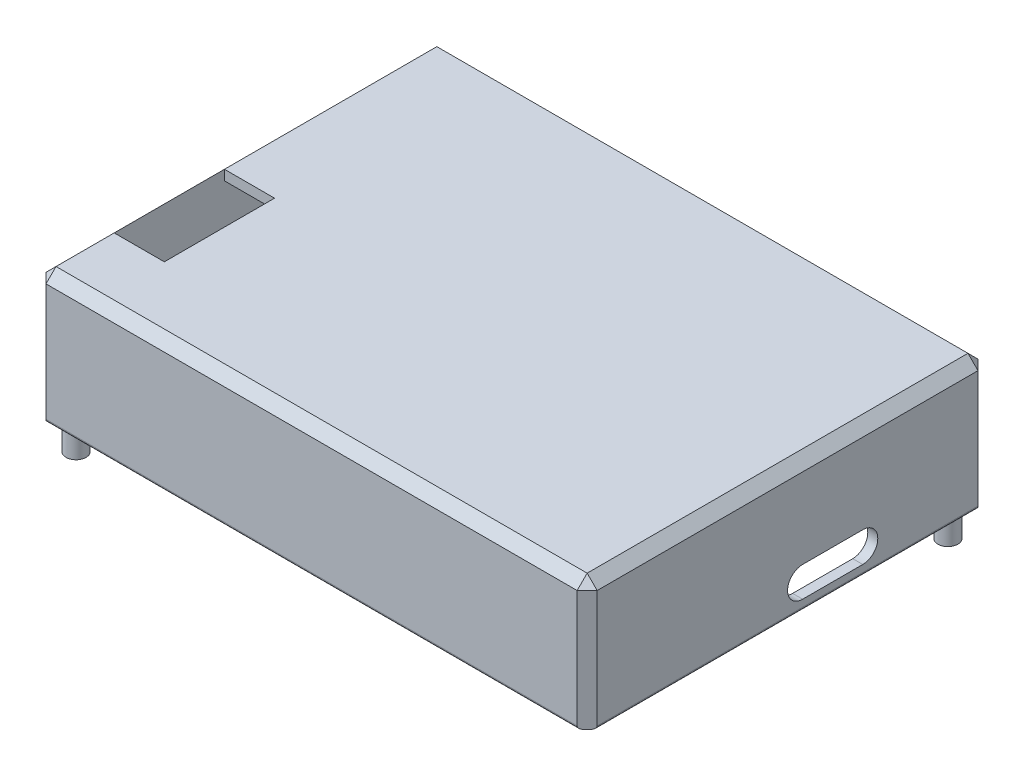
from build123d import *

# Parameters (mm, degrees)
SKETCH_1_W          = 55
SKETCH_1_H          = 40
EXTRUDE_1_DEPTH     = 13
SHELL_1_T           = -1
CHAMFER_1_SIZE      = 1
CUT_EXTRUDE_3_DEPTH = 2
EXTRUDE_5_DEPTH     = 12
SKETCH_16_W         = 5
SKETCH_16_H         = 11
CUT_EXTRUDE_4_DEPTH = 1
SKETCH_18_W         = 8
SKETCH_18_H         = 8
CUT_EXTRUDE_5_DEPTH = 10
SKETCH_19_W         = 1
SKETCH_19_H         = 8
EXTRUDE_6_DEPTH     = 1
SKETCH_21_W         = 0.2
SKETCH_21_H         = 1
CUT_EXTRUDE_6_DEPTH = 12
SKETCH_20_W         = 1.5
SKETCH_20_H         = 10
EXTRUDE_8_DEPTH     = 17.5
EXTRUDE_9_DEPTH     = 10
SKETCH_7_R          = 1
EXTRUDE_4_DEPTH     = 3
FILLET_1_R          = 2
FILLET_2_R          = 0.3
FILLET_3_R          = 0.3


with BuildPart() as part:
    # 草图1 → 凸台-拉伸1 (new body)
    with BuildSketch(Plane(origin=(0, 0, 0), x_dir=(1, 0, 0), z_dir=(0, 1, 0))):
        Rectangle(SKETCH_1_W, SKETCH_1_H)
    extrude(amount=EXTRUDE_1_DEPTH)

    # 抽壳1
    shell_1_openings = [part.faces().sort_by_distance(p)[0] for p in [
        (0, 0, 0),
    ]]
    offset(amount=SHELL_1_T, openings=shell_1_openings, kind=Kind.INTERSECTION)

    # 倒角1
    chamfer_1_edges = [part.edges().sort_by_distance(p)[0] for p in [
        (27.5, 13, 0),
        (0, 13, -20),
        (-27.5, 13, 0),
        (0, 13, 20),
        (-27.5, 6.5, -20),
        (27.5, 6.5, -20),
        (27.5, 6.5, 20),
        (-27.5, 6.5, 20),
    ]]
    chamfer(chamfer_1_edges, length=CHAMFER_1_SIZE)

    # 草图4 → 切除-拉伸3 (cut)
    with BuildSketch(Plane(origin=(27.5, 0, 0), x_dir=(0, 0, -1), z_dir=(1, 0, 0))):
        with BuildLine():
            Line((1.5, 4), (7.5, 4))
            ThreePointArc((7.5, 4), (9, 2.5), (7.5, 1))
            Line((7.5, 1), (1.5, 1))
            ThreePointArc((1.5, 1), (0, 2.5), (1.5, 4))
        make_face()
    extrude(amount=-CUT_EXTRUDE_3_DEPTH, mode=Mode.SUBTRACT)

    # 草图12 → 凸台-拉伸5 (add)
    with BuildSketch(Plane.XZ):
        with BuildLine():
            Line((26.5, -19), (23.5, -19))
            ThreePointArc((23.5, -19), (24.12244212, -16.62244212), (26.5, -16))
            Line((26.5, -16), (26.5, -19))
        make_face()
        with BuildLine():
            Line((-26.5, 19), (-23.5, 19))
            ThreePointArc((-23.5, 19), (-24.12244212, 16.62244212), (-26.5, 16))
            Line((-26.5, 16), (-26.5, 19))
        make_face()
    extrude(amount=-EXTRUDE_5_DEPTH)

    # 草图16 → 切除-拉伸4 (cut)
    with BuildSketch(Plane(origin=(0, 13, 0), x_dir=(1, 0, 0), z_dir=(0, 1, 0))):
        with Locations((-24, -7.69336468)):
            Rectangle(SKETCH_16_W, SKETCH_16_H)
    extrude(amount=-CUT_EXTRUDE_4_DEPTH, mode=Mode.SUBTRACT)

    # 草图18 → 切除-拉伸5 (cut)
    with BuildSketch(Plane.ZY.offset(27.5)):
        with Locations((-7, 4)):
            Rectangle(SKETCH_18_W, SKETCH_18_H)
    extrude(amount=-CUT_EXTRUDE_5_DEPTH, mode=Mode.SUBTRACT)

    # 草图19 → 凸台-拉伸6 (add)
    with BuildSketch(Plane(origin=(-26.5, 0, 0), x_dir=(0, 0, -1), z_dir=(1, 0, 0))):
        with Locations((2.5, 4)):
            Rectangle(SKETCH_19_W, SKETCH_19_H)
        with Locations((11.5, 4)):
            Rectangle(SKETCH_19_W, SKETCH_19_H)
    extrude(amount=EXTRUDE_6_DEPTH)

    # 草图21 → 切除-拉伸6 (cut)
    with BuildSketch(Plane.XZ):
        with Locations((-25.6, -11.5)):
            Rectangle(SKETCH_21_W, SKETCH_21_H)
        with Locations((-25.6, -2.5)):
            Rectangle(SKETCH_21_W, SKETCH_21_H)
    extrude(amount=-CUT_EXTRUDE_6_DEPTH, mode=Mode.SUBTRACT)

    # 草图20 → 凸台-拉伸8 (add)
    with BuildSketch(Plane.XZ.offset(-12)):
        with Locations((-24.25, -7)):
            Rectangle(SKETCH_20_W, SKETCH_20_H)
    extrude(amount=EXTRUDE_8_DEPTH)

    # 草图22 → 凸台-拉伸9 (add)
    with BuildSketch(Plane(origin=(0, 0, -12), x_dir=(-1, 0, 0), z_dir=(0, 0, -1))):
        Polygon((25, -5.5), (26.5, -4), (26.5, -3), (25, -3), align=None)
    extrude(amount=-EXTRUDE_9_DEPTH)

    # 草图7 → 凸台-拉伸4 (add)
    with BuildSketch(Plane.XZ):
        with Locations(Location((-25.5, 18, 0), (0, 0, 90))):
            Circle(SKETCH_7_R)
        with Locations(Location((25.5, -18, 0), (0, 0, 90))):
            Circle(SKETCH_7_R)
    extrude(amount=EXTRUDE_4_DEPTH)

    # 圆角1
    # the kernel refuses this fillet: 2 mm, written as the material it adds along each edge
    with BuildSketch(Plane(origin=(-25, 12, -12), x_dir=(-1, 0, 0), z_dir=(0, 0, 1)), Plane(origin=(-23.5, 12, -2), x_dir=(1, 0, 0), z_dir=(0, 0, -1))) as fillet_1_piece_1:
        with BuildLine():
            CenterArc((FILLET_1_R, FILLET_1_R), FILLET_1_R, 180, 90)
            Line((0, FILLET_1_R), (0, 0))
            Line((0, 0), (FILLET_1_R, 0))
        make_face()
    extrude(amount=10)

    # 圆角2
    fillet_2_edges = [part.edges().sort_by_distance(p)[0] for p in [
        (-25, -5.5, -7),
        (-24.25, -5.5, -12),
        (-23.5, -5.5, -7),
        (-24.25, -5.5, -2),
        (-25, -3, -7),
        (-26.5, -3, -7),
        (-26.5, -4, -7),
        (-25.75, -4.75, -12),
        (-25.75, -4.75, -2),
    ]]
    fillet(fillet_2_edges, radius=FILLET_2_R)

    # 圆角3
    fillet_3_edges = [part.edges().sort_by_distance(p)[0] for p in [
        (-27.5, 0, 8),
        (-27.5, 4, -11),
        (-27.5, 4, -3),
        (-26.6, 0, -3),
        (-26.6, 0, -11),
        (-27.5, 0, -15),
        (0, 0, -20),
        (27.5, 0, 0),
        (0, 0, 20),
    ]]
    fillet(fillet_3_edges, radius=FILLET_3_R)


solid = part.part
